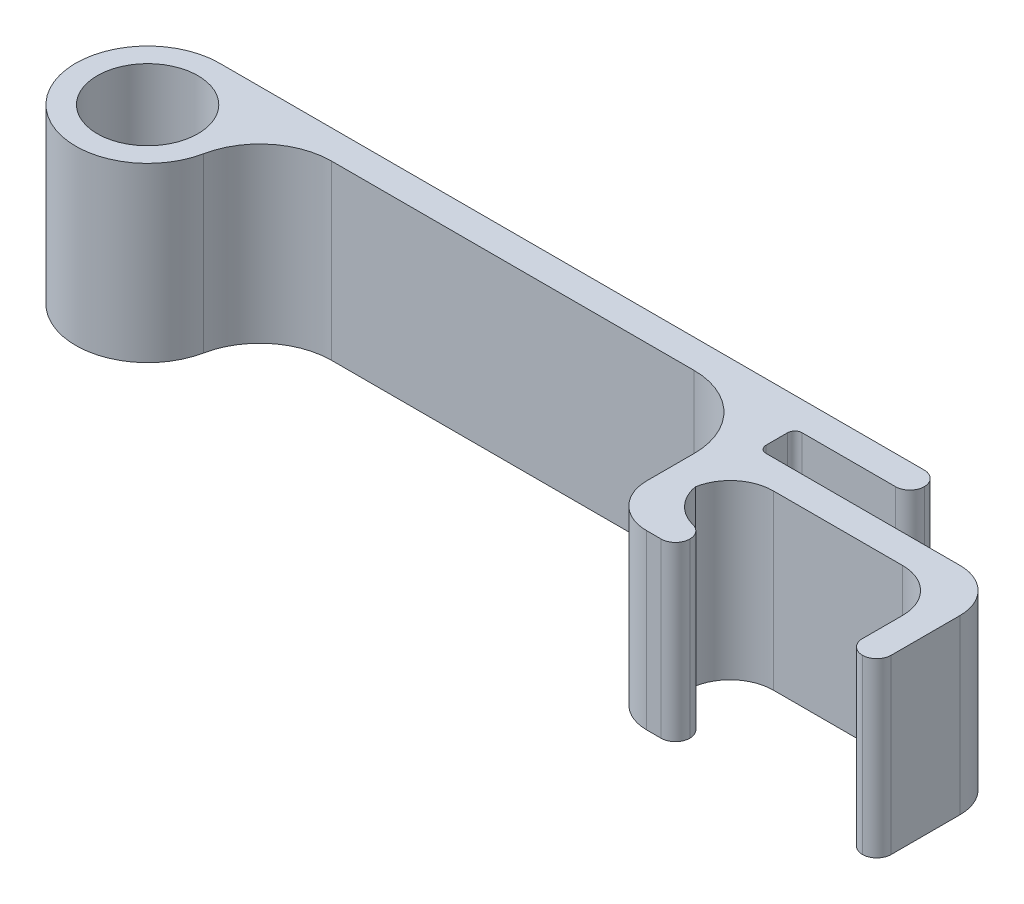
from build123d import *

# Parameters (mm, degrees)
SKETCH1_R           = 5
BOSS_EXTRUDE1_DEPTH = 12
SKETCH2_R           = 3.5
CUT_EXTRUDE1_DEPTH  = 14.928388277
BOSS_EXTRUDE2_START = -12
BOSS_EXTRUDE2_DEPTH = 12
BOSS_EXTRUDE3_DEPTH = 12
BOSS_EXTRUDE4_DEPTH = 12
FILLET1_R           = 1
FILLET2_R           = 3
FILLET3_R           = 5
FILLET4_R           = 5
FILLET5_R           = 0.5
SKETCH7_W           = 0.628205129
SKETCH7_H           = 3.58974359
CUT_EXTRUDE2_DEPTH  = 0.5


# Some blends are built 0.0001 mm under size
with BuildPart() as part:
    # Sketch1 → Boss-Extrude1 (new body)
    with BuildSketch(Plane(origin=(0, 0, 0), x_dir=(1, 0, 0), z_dir=(0, 1, 0))):
        with Locations(Location((0, 0, 0), (0, 0, 270))):
            Circle(SKETCH1_R)
    extrude(amount=BOSS_EXTRUDE1_DEPTH)

    # Sketch2 → Cut-Extrude1 (cut, through all)
    with BuildSketch(Plane(origin=(0, 12, 0), x_dir=(1, 0, 0), z_dir=(0, 1, 0))):
        with Locations(Location((0, 0, 0), (0, 0, 270))):
            Circle(SKETCH2_R)
    extrude(amount=-CUT_EXTRUDE1_DEPTH, mode=Mode.SUBTRACT)

    # Sketch3 → Boss-Extrude2 (add)
    with BuildSketch(Plane(origin=(0, 12, 0), x_dir=(1, 0, 0), z_dir=(0, 1, 0)).offset(BOSS_EXTRUDE2_START)):
        with BuildLine():
            Line((0, 5), (50, 5))
            Line((50, 5), (50, 3))
            Line((50, 3), (4, 3))
            ThreePointArc((4, 3), (2.236067977, 4.472135955), (0, 5))
        make_face()
    extrude(amount=BOSS_EXTRUDE2_DEPTH)

    # Sketch4 → Boss-Extrude3 (add)
    with BuildSketch(Plane(origin=(0, 12, 0), x_dir=(1, 0, 0), z_dir=(0, 1, 0))):
        Polygon((40, 3), (40, -8.3), (45, -8.3), (45, -6.3), (42, -6.3), (42, 3), align=None)
    extrude(amount=-BOSS_EXTRUDE3_DEPTH)

    # Sketch6 → Boss-Extrude4 (add)
    with BuildSketch(Plane(origin=(0, 12, 0), x_dir=(1, 0, 0), z_dir=(0, 1, 0))):
        Polygon((42, 0.5), (59, 0.5), (59, -1.5), (59, -8.3), (57, -8.3), (57, -1.5), (42, -1.5), align=None)
    extrude(amount=-BOSS_EXTRUDE4_DEPTH)

    # Fillet1
    fillet1_edges = [part.edges().sort_by_distance(p)[0] for p in [
        (59, 6, 8.3),
        (57, 6, 8.3),
        (45, 6, 8.3),
        (45, 6, 6.3),
        (50, 6, -5),
        (50, 6, -3),
    ]]
    fillet(fillet1_edges, radius=FILLET1_R - 0.0001)  # a hair under: the kernel refuses the full size

    # Fillet2
    # the kernel refuses this fillet: 3 mm, written as the material it adds along each edge
    with BuildSketch(Plane(origin=(57, 12, 1.5), x_dir=(0, 0, 1), z_dir=(0, -1, 0)), Plane(origin=(42, 12, 1.5), x_dir=(1, 0, 0), z_dir=(0, -1, 0))) as fillet2_piece_1:
        with BuildLine():
            CenterArc((FILLET2_R, FILLET2_R), FILLET2_R, 180, 90)
            Line((0, FILLET2_R), (0, 0))
            Line((0, 0), (FILLET2_R, 0))
        make_face()
    extrude(amount=12)
    with BuildSketch(Plane(origin=(42, 12, 6.3), x_dir=(0, 0, -1), z_dir=(0, -1, 0))) as fillet2_piece_2:
        with BuildLine():
            CenterArc((2.873005886, 3), FILLET2_R, 194.476402633, 75.523597367)
            Line((-0.031746147, 2.250056251), (-0.322221351, 2.175061877))
            ThreePointArc((-0.322221351, 2.175061877), (-0.3, 2.0001), (-0.3, 0))
            Line((-0.3, 0), (0, -0.3))
            Line((0, -0.3), (2.873005886, -0.3))
            Line((2.873005886, -0.3), (2.873005886, 0))
        make_face()
    extrude(amount=12)
    # the kernel refuses this fillet: 3 mm, written as the material it takes off along each edge
    with BuildSketch(Plane(origin=(59, 19.5, -0.5), x_dir=(-1, 0, 0), z_dir=(0, -1, 0)), Plane(origin=(40, 19.5, 8.3), x_dir=(1, 0, 0), z_dir=(0, -1, 0))) as fillet2_2_piece_1:
        with BuildLine():
            CenterArc((FILLET2_R, -FILLET2_R), FILLET2_R, 90, 90)
            Line((0, -FILLET2_R), (0, 0))
            Line((0, 0), (FILLET2_R, 0))
        make_face()
    extrude(amount=27, mode=Mode.SUBTRACT)

    # Fillet3
    fillet3_edges = [part.edges().sort_by_distance(p)[0] for p in [
        (40, 6, -3),
    ]]
    fillet(fillet3_edges, radius=FILLET3_R)

    # Fillet4
    fillet4_edges = [part.edges().sort_by_distance(p)[0] for p in [
        (4, 6, -3),
    ]]
    fillet(fillet4_edges, radius=FILLET4_R)

    # Fillet5
    fillet5_edges = [part.edges().sort_by_distance(p)[0] for p in [
        (42, 6, -3),
        (42, 6, -0.5),
    ]]
    fillet(fillet5_edges, radius=FILLET5_R)

    # Sketch7 → Cut-Extrude2 (cut)
    # profile 1 of 8: a face of its own
    with BuildSketch(Plane(origin=(0, 0, -5), x_dir=(-1, 0, 0), z_dir=(0, 0, -1))):
        Polygon((-34.160296283, 7.658316714), (-33.577664072, 7.658316714), (-32.164202533, 4.158316714), (-32.835176091, 4.158316714), (-33.107211347, 4.876265432), (-34.632151251, 4.876265432), (-34.904186507, 4.158316714), (-35.574458943, 4.158316714), align=None)
        Polygon((-33.869330738, 6.719514631), (-34.393769841, 5.50447056), (-33.344891636, 5.50447056), align=None, mode=Mode.SUBTRACT)
    # profile 2 of 8: a face of its own
    with BuildSketch(Plane(origin=(0, 0, -5), x_dir=(-1, 0, 0), z_dir=(0, 0, -1))):
        with Locations((-31.468689713, 5.953188509)):
            Rectangle(SKETCH7_W, SKETCH7_H)
    # profile 3 of 8: a face of its own
    with BuildSketch(Plane(origin=(0, 0, -5), x_dir=(-1, 0, 0), z_dir=(0, 0, -1))):
        with BuildLine():
            Line((-28.015664873, 5.280111586), (-30.032792277, 5.280111586))
            add(Edge.make_bspline(
                [(-30.032792277, 5.280111586), (-30.028679517, 5.25667371), (-30.020597619, 5.210616434), (-30.003047491, 5.143714245), (-29.980650895, 5.080666751), (-29.953809986, 5.021389673), (-29.9229773, 4.965569637), (-29.887013527, 4.91346846), (-29.846374833, 4.865132162), (-29.801296182, 4.820770818), (-29.752528952, 4.781022091), (-29.700309646, 4.746199694), (-29.644584378, 4.717647459), (-29.585992016, 4.693580887), (-29.524094741, 4.674517725), (-29.458801455, 4.661370224), (-29.390285242, 4.653603947), (-29.343609904, 4.652480644), (-29.319751411, 4.651906458)],
                knots=[0, 0, 0, 0, 1.091296461, 2.144483647, 3.168565212, 4.157007626, 5.126487748, 6.090021542, 7.05641414, 8.019231907, 8.98705074, 9.938580405, 10.892824166, 11.854447369, 12.841318655, 13.858982407, 14.905600794, 16, 16, 16, 16], degree=3))
            add(Edge.make_bspline(
                [(-29.319751411, 4.651906458), (-29.290952591, 4.652666775), (-29.234239233, 4.654164062), (-29.151153741, 4.667442778), (-29.070797967, 4.687499694), (-28.993932361, 4.717326013), (-28.919666554, 4.754454536), (-28.84922319, 4.800712108), (-28.78138295, 4.85474693), (-28.739992409, 4.89639695), (-28.718890033, 4.917631618)],
                knots=[0, 0, 0, 0, 1.021034703, 2.010718019, 2.977989445, 3.954245119, 4.929443971, 5.918328161, 6.938689359, 8, 8, 8, 8], degree=3))
            Line((-28.718890033, 4.917631618), (-28.193048687, 4.667331137))
            add(Edge.make_bspline(
                [(-28.193048687, 4.667331137), (-28.209604495, 4.644453552), (-28.242409219, 4.599122457), (-28.295961831, 4.5353299), (-28.351847392, 4.475808856), (-28.41010758, 4.420950804), (-28.470816285, 4.370912068), (-28.533804629, 4.325083087), (-28.599993162, 4.284694349), (-28.668058456, 4.247791872), (-28.739407546, 4.216155549), (-28.813842978, 4.18917721), (-28.891049475, 4.164789021), (-28.97200199, 4.146206557), (-29.056026432, 4.131496831), (-29.143323802, 4.121050976), (-29.233882597, 4.114599072), (-29.295434882, 4.113834206), (-29.326762629, 4.113444919)],
                knots=[0, 0, 0, 0, 1.028154879, 2.037251081, 3.030720504, 4.000128189, 4.949298328, 5.894184978, 6.834267904, 7.770992897, 8.712077017, 9.673380525, 10.653304757, 11.658697181, 12.695551717, 13.758623199, 14.859225354, 16, 16, 16, 16], degree=3))
            add(Edge.make_bspline(
                [(-29.326762629, 4.113444919), (-29.374959854, 4.114427516), (-29.469351341, 4.116351874), (-29.607415955, 4.134212675), (-29.738539044, 4.163827807), (-29.863090854, 4.204085031), (-29.98053299, 4.257237178), (-30.090923575, 4.322246663), (-30.195365567, 4.397867125), (-30.290667681, 4.485685634), (-30.377490719, 4.581270861), (-30.453750677, 4.683922867), (-30.517563924, 4.792924462), (-30.569968645, 4.907554251), (-30.610699416, 5.02810564), (-30.640063938, 5.154631237), (-30.658064743, 5.287070609), (-30.660008919, 5.377276605), (-30.660997405, 5.423140432)],
                knots=[0, 0, 0, 0, 1.103565453, 2.161269334, 3.182010356, 4.179077853, 5.15417608, 6.128274628, 7.109042802, 8.101804412, 9.090965879, 10.063106201, 11.02526161, 11.978650795, 12.945248442, 13.93468508, 14.949922959, 16, 16, 16, 16], degree=3))
            add(Edge.make_bspline(
                [(-30.660997405, 5.423140432), (-30.65999919, 5.470169718), (-30.658035247, 5.562697725), (-30.640218925, 5.698195183), (-30.610618233, 5.827478085), (-30.569768316, 5.950724467), (-30.51815858, 6.06831979), (-30.453533419, 6.179235237), (-30.377528562, 6.283856955), (-30.291018303, 6.381695513), (-30.19531246, 6.470005501), (-30.093615959, 6.548707348), (-29.984786137, 6.61428695), (-29.870053952, 6.667275229), (-29.750153273, 6.710326868), (-29.623698215, 6.738974138), (-29.491650909, 6.758209065), (-29.401386279, 6.759980481), (-29.355508623, 6.760880817)],
                knots=[0, 0, 0, 0, 1.079208495, 2.12329425, 3.130605359, 4.119693003, 5.099659317, 6.073216462, 7.060498243, 8.06384408, 9.066070512, 10.045757761, 11.010926815, 11.975797609, 12.942977511, 13.929384301, 14.947594487, 16, 16, 16, 16], degree=3))
            add(Edge.make_bspline(
                [(-29.355508623, 6.760880817), (-29.3070805, 6.759882976), (-29.211996873, 6.757923819), (-29.072970682, 6.740208044), (-28.940976952, 6.710412322), (-28.815453314, 6.670503195), (-28.698002758, 6.616008369), (-28.586044539, 6.552598664), (-28.482264049, 6.475343609), (-28.385555099, 6.387954855), (-28.298255507, 6.291000061), (-28.221945991, 6.18567746), (-28.157015985, 6.073014937), (-28.10438957, 5.952555624), (-28.063700623, 5.82466115), (-28.034308918, 5.689497612), (-28.016445417, 5.546550912), (-28.014537418, 5.448667114), (-28.013561507, 5.398601169)],
                knots=[0, 0, 0, 0, 1.080001299, 2.120471247, 3.119684163, 4.095710327, 5.052285597, 6.002875087, 6.961153713, 7.931888285, 8.906493152, 9.865905668, 10.82813294, 11.801621613, 12.7925306, 13.817193356, 14.883530496, 16, 16, 16, 16], degree=3))
            Line((-28.013561507, 5.398601169), (-28.015664873, 5.280111586))
        make_face()
        with BuildLine():
            add(Edge.make_bspline(
                [(-28.641766636, 5.77370133), (-28.653621251, 5.805692133), (-28.677191313, 5.869298185), (-28.730435104, 5.957059016), (-28.801087911, 6.03306346), (-28.883262194, 6.100350797), (-28.977151457, 6.154965403), (-29.079797087, 6.194508151), (-29.189901661, 6.218218479), (-29.265647674, 6.220999284), (-29.304326732, 6.222419278)],
                knots=[0, 0, 0, 0, 0.954238005, 1.897273737, 2.851915805, 3.847685534, 4.862635127, 5.880135777, 6.917509367, 8, 8, 8, 8], degree=3))
            add(Edge.make_bspline(
                [(-29.304326732, 6.222419278), (-29.34657056, 6.221055201), (-29.429148448, 6.218388713), (-29.54826143, 6.19002964), (-29.660617725, 6.147704571), (-29.726856629, 6.104066526), (-29.760055898, 6.082194919)],
                knots=[0, 0, 0, 0, 1.044195649, 2.041185066, 3.018232172, 4, 4, 4, 4], degree=3))
            add(Edge.make_bspline(
                [(-29.760055898, 6.082194919), (-29.780769763, 6.065537025), (-29.824930663, 6.030023246), (-29.882282552, 5.959176628), (-29.938774639, 5.873397277), (-29.970893505, 5.808241801), (-29.987920482, 5.77370133)],
                knots=[0, 0, 0, 0, 0.82159062, 1.751589201, 2.808063854, 4, 4, 4, 4], degree=3))
            Line((-29.987920482, 5.77370133), (-28.641766636, 5.77370133))
        make_face(mode=Mode.SUBTRACT)
    # profile 4 of 8: a face of its own
    with BuildSketch(Plane(origin=(0, 0, -5), x_dir=(-1, 0, 0), z_dir=(0, 0, -1))):
        Polygon((-27.660897245, 6.716009022), (-26.95206311, 6.716009022), (-26.446554296, 6.019093958), (-25.943148847, 6.716009022), (-25.234314713, 6.716009022), (-26.091085546, 5.529009823), (-25.096894841, 4.158316714), (-25.805728975, 4.158316714), (-26.44445093, 5.038925689), (-27.080368398, 4.158316714), (-27.789202533, 4.158316714), (-26.79991968, 5.529009823), align=None)
    # profile 5 of 8: a face of its own
    with BuildSketch(Plane(origin=(0, 0, -5), x_dir=(-1, 0, 0), z_dir=(0, 0, -1))):
        Polygon((-23.346894841, 7.658316714), (-21.641766636, 7.658316714), (-21.641766636, 7.030111586), (-22.718689713, 7.030111586), (-22.718689713, 6.357034663), (-21.641766636, 6.357034663), (-21.641766636, 5.728829535), (-22.718689713, 5.728829535), (-22.718689713, 4.158316714), (-23.346894841, 4.158316714), align=None)
    # profile 6 of 8: a face of its own
    with BuildSketch(Plane(origin=(0, 0, -5), x_dir=(-1, 0, 0), z_dir=(0, 0, -1))):
        with BuildLine():
            Line((-19.173817918, 6.716009022), (-18.545612789, 6.716009022))
            Line((-18.545612789, 6.716009022), (-18.545612789, 4.158316714))
            Line((-18.545612789, 4.158316714), (-19.173817918, 4.158316714))
            Line((-19.173817918, 4.158316714), (-19.173817918, 4.437363189))
            add(Edge.make_bspline(
                [(-19.173817918, 4.437363189), (-19.20494525, 4.410201103), (-19.265357256, 4.357484858), (-19.360547029, 4.28908419), (-19.456014957, 4.232662479), (-19.552219767, 4.187725664), (-19.650640085, 4.154544451), (-19.7519845, 4.130520477), (-19.857712478, 4.116352952), (-19.929584901, 4.114424361), (-19.966085546, 4.113444919)],
                knots=[0, 0, 0, 0, 1.129196829, 2.191548051, 3.199897424, 4.157751732, 5.089409408, 6.034969131, 7.002052659, 8, 8, 8, 8], degree=3))
            add(Edge.make_bspline(
                [(-19.966085546, 4.113444919), (-20.007059142, 4.114366697), (-20.08802529, 4.116188182), (-20.206834124, 4.135362252), (-20.321555864, 4.164712439), (-20.43209739, 4.206246622), (-20.538257579, 4.260066781), (-20.640848881, 4.324768672), (-20.738112566, 4.402623719), (-20.830858323, 4.490263333), (-20.915775782, 4.586667531), (-20.990011426, 4.690498238), (-21.052586557, 4.800282843), (-21.103851013, 4.91565736), (-21.144177128, 5.03653711), (-21.172923878, 5.163305488), (-21.189884493, 5.296007769), (-21.191983739, 5.386399366), (-21.193048687, 5.432255016)],
                knots=[0, 0, 0, 0, 0.980476535, 1.937477201, 2.874147792, 3.812856188, 4.758993464, 5.720109578, 6.712210464, 7.737600662, 8.772720504, 9.783789959, 10.789002326, 11.793715968, 12.802552247, 13.835794126, 14.902098527, 16, 16, 16, 16], degree=3))
            add(Edge.make_bspline(
                [(-21.193048687, 5.432255016), (-21.191931021, 5.479738601), (-21.189738593, 5.572882946), (-21.17370112, 5.709567843), (-21.145484856, 5.839479432), (-21.107009952, 5.962797661), (-21.057518669, 6.079543833), (-20.997241593, 6.189909217), (-20.925358711, 6.293605334), (-20.842526432, 6.388867204), (-20.753087916, 6.47617931), (-20.657404514, 6.552191422), (-20.556972507, 6.616767248), (-20.451685168, 6.669486181), (-20.341557532, 6.710224705), (-20.227024382, 6.740007893), (-20.10757727, 6.757878852), (-20.02620893, 6.759871852), (-19.985015834, 6.760880817)],
                knots=[0, 0, 0, 0, 1.136281865, 2.228943489, 3.287578264, 4.313574083, 5.316051562, 6.317280042, 7.318008486, 8.329309503, 9.333984563, 10.305318864, 11.248632312, 12.186624717, 13.117503092, 14.05354244, 15.014596925, 16, 16, 16, 16], degree=3))
            add(Edge.make_bspline(
                [(-19.985015834, 6.760880817), (-19.94685768, 6.760088073), (-19.871356447, 6.758519519), (-19.760380513, 6.741488026), (-19.652749864, 6.715729101), (-19.549051628, 6.67902727), (-19.44843524, 6.632683741), (-19.352631365, 6.574611846), (-19.259544206, 6.507252319), (-19.202746402, 6.454643102), (-19.173817918, 6.427847964)],
                knots=[0, 0, 0, 0, 1.017011718, 2.012299608, 2.98747302, 3.965332399, 4.941441765, 5.936729654, 6.94912688, 8, 8, 8, 8], degree=3))
            Line((-19.173817918, 6.427847964), (-19.173817918, 6.716009022))
        make_face()
        with BuildLine():
            add(Edge.make_bspline(
                [(-19.853204937, 6.177547484), (-19.878237059, 6.176779412), (-19.927298385, 6.175274041), (-19.999449779, 6.16621913), (-20.068404866, 6.150263974), (-20.133671866, 6.126693658), (-20.196223495, 6.097981578), (-20.255109899, 6.062020171), (-20.310817083, 6.019514552), (-20.363017429, 5.971493781), (-20.410605735, 5.918710174), (-20.451629632, 5.861111823), (-20.486493317, 5.800250675), (-20.515978934, 5.735943743), (-20.537083946, 5.667430076), (-20.553799106, 5.595601601), (-20.562473192, 5.519871515), (-20.564045531, 5.468263805), (-20.564843559, 5.442070721)],
                knots=[0, 0, 0, 0, 1.04836806, 2.054732945, 3.03993516, 4.00574415, 4.955904794, 5.917688631, 6.888591924, 7.88601754, 8.884115178, 9.859153345, 10.841239365, 11.818093293, 12.814750328, 13.83810466, 14.90274714, 16, 16, 16, 16], degree=3))
            add(Edge.make_bspline(
                [(-20.564843559, 5.442070721), (-20.564057721, 5.41564005), (-20.562509237, 5.36355872), (-20.553658855, 5.287189823), (-20.537545175, 5.214312103), (-20.514035923, 5.145514724), (-20.485325673, 5.079869384), (-20.450378843, 5.017679041), (-20.407452783, 4.960043299), (-20.359822761, 4.905598302), (-20.306551533, 4.856981032), (-20.250529135, 4.813813361), (-20.190990345, 4.777694998), (-20.128581116, 4.748503908), (-20.063511521, 4.724715624), (-19.994965784, 4.708960992), (-19.923615397, 4.698889353), (-19.874973954, 4.697486812), (-19.85040045, 4.696778253)],
                knots=[0, 0, 0, 0, 1.099136573, 2.165835871, 3.191374663, 4.196217796, 5.183857741, 6.167377911, 7.154730987, 8.166690795, 9.170734848, 10.148332609, 11.103258353, 12.059567475, 13.009337315, 13.978056681, 14.978520572, 16, 16, 16, 16], degree=3))
            add(Edge.make_bspline(
                [(-19.85040045, 4.696778253), (-19.824902075, 4.697550631), (-19.774911398, 4.699064911), (-19.701582891, 4.708037186), (-19.631701489, 4.724050843), (-19.565557937, 4.747756105), (-19.502141954, 4.776262089), (-19.442025812, 4.811520782), (-19.385861863, 4.853928863), (-19.333365663, 4.902383743), (-19.285263014, 4.955598359), (-19.243671789, 5.013952022), (-19.20744431, 5.075578419), (-19.178953064, 5.141934625), (-19.15632702, 5.211859714), (-19.140093355, 5.285787658), (-19.131263183, 5.363798159), (-19.129728241, 5.417043366), (-19.128946123, 5.444174086)],
                knots=[0, 0, 0, 0, 1.050008698, 2.058587853, 3.036635738, 3.995319155, 4.947022481, 5.895997462, 6.858296291, 7.838991643, 8.833936038, 9.806048392, 10.784806122, 11.771666913, 12.772873988, 13.80724452, 14.882696879, 16, 16, 16, 16], degree=3))
            add(Edge.make_bspline(
                [(-19.128946123, 5.444174086), (-19.129718523, 5.470838171), (-19.131227244, 5.522920874), (-19.140131437, 5.599302553), (-19.156480352, 5.671778889), (-19.178640715, 5.740483105), (-19.207638828, 5.805258107), (-19.243893718, 5.865385697), (-19.285028712, 5.922949069), (-19.333663926, 5.974726065), (-19.385875743, 6.022830094), (-19.442865674, 6.063955723), (-19.502838226, 6.099398932), (-19.566161872, 6.128499173), (-19.63342296, 6.149830752), (-19.703423785, 6.166347014), (-19.777256503, 6.175268606), (-19.827475662, 6.176775462), (-19.853204937, 6.177547484)],
                knots=[0, 0, 0, 0, 1.106611376, 2.161533483, 3.185006901, 4.184773755, 5.152708835, 6.122342771, 7.094156588, 8.082475533, 9.064254463, 10.03606828, 10.992420271, 11.951521816, 12.920622147, 13.915721683, 14.932141191, 16, 16, 16, 16], degree=3))
        make_face(mode=Mode.SUBTRACT)
    # profile 7 of 8: a face of its own
    with BuildSketch(Plane(origin=(0, 0, -5), x_dir=(-1, 0, 0), z_dir=(0, 0, -1))):
        with BuildLine():
            Line((-18.007151251, 6.716009022), (-17.468689713, 6.716009022))
            Line((-17.468689713, 6.716009022), (-17.468689713, 6.401205336))
            add(Edge.make_bspline(
                [(-17.468689713, 6.401205336), (-17.453457669, 6.429182026), (-17.423686009, 6.483863628), (-17.368992972, 6.557262849), (-17.306159396, 6.619077626), (-17.237443085, 6.670600869), (-17.162635774, 6.710758179), (-17.08374067, 6.739375324), (-17.001432719, 6.757972503), (-16.945285024, 6.759904399), (-16.91690686, 6.760880817)],
                knots=[0, 0, 0, 0, 1.09866127, 2.147379032, 3.14564304, 4.131443017, 5.102343063, 6.064490016, 7.021754664, 8, 8, 8, 8], degree=3))
            add(Edge.make_bspline(
                [(-16.91690686, 6.760880817), (-16.896300772, 6.759915912), (-16.854339418, 6.75795102), (-16.79038441, 6.746529074), (-16.725506644, 6.725876023), (-16.682811484, 6.707280696), (-16.660997405, 6.697779855)],
                knots=[0, 0, 0, 0, 0.931404136, 1.896671404, 2.925354185, 4, 4, 4, 4], degree=3))
            Line((-16.660997405, 6.697779855), (-16.855909264, 6.165628413))
            add(Edge.make_bspline(
                [(-16.855909264, 6.165628413), (-16.873331601, 6.174046044), (-16.906078887, 6.189867949), (-16.953622261, 6.208539428), (-16.996769844, 6.219931851), (-17.02412462, 6.221631701), (-17.036798687, 6.222419278)],
                knots=[0, 0, 0, 0, 1.214386998, 2.282580073, 3.20428172, 4, 4, 4, 4], degree=3))
            add(Edge.make_bspline(
                [(-17.036798687, 6.222419278), (-17.048765471, 6.221897388), (-17.072306197, 6.22087074), (-17.107051649, 6.212072711), (-17.13977463, 6.196900784), (-17.172052058, 6.177464039), (-17.201337602, 6.15044551), (-17.230605057, 6.119166765), (-17.256397105, 6.080548995), (-17.283615196, 6.037565455), (-17.306790427, 5.984953641), (-17.326662475, 5.922145977), (-17.344368628, 5.848415736), (-17.356552879, 5.763371445), (-17.368329447, 5.667836055), (-17.37533915, 5.561108348), (-17.38056357, 5.443525808), (-17.380883008, 5.361448951), (-17.381049488, 5.318673285)],
                knots=[0, 0, 0, 0, 0.544232178, 1.070598461, 1.618251235, 2.182094276, 2.777567932, 3.425210017, 4.127676488, 4.886675562, 5.738955394, 6.734782583, 7.883056018, 9.186093582, 10.642914445, 12.264202625, 14.053029461, 16, 16, 16, 16], degree=3))
            Line((-17.381049488, 5.318673285), (-17.378946123, 5.193873605))
            Line((-17.378946123, 5.193873605), (-17.378946123, 4.158316714))
            Line((-17.378946123, 4.158316714), (-18.007151251, 4.158316714))
            Line((-18.007151251, 4.158316714), (-18.007151251, 6.716009022))
        make_face()
    # profile 8 of 8: a face of its own
    with BuildSketch(Plane(origin=(0, 0, -5), x_dir=(-1, 0, 0), z_dir=(0, 0, -1))):
        with BuildLine():
            Line((-13.791305898, 5.280111586), (-15.808433302, 5.280111586))
            add(Edge.make_bspline(
                [(-15.808433302, 5.280111586), (-15.804320542, 5.25667371), (-15.796238645, 5.210616434), (-15.778688517, 5.143714245), (-15.756291921, 5.080666751), (-15.729451012, 5.021389673), (-15.698618326, 4.965569637), (-15.662654552, 4.91346846), (-15.622015859, 4.865132162), (-15.576937208, 4.820770818), (-15.528169978, 4.781022091), (-15.475950672, 4.746199694), (-15.420225403, 4.717647459), (-15.361633041, 4.693580887), (-15.299735766, 4.674517725), (-15.234442481, 4.661370224), (-15.165926267, 4.653603947), (-15.11925093, 4.652480644), (-15.095392437, 4.651906458)],
                knots=[0, 0, 0, 0, 1.091296461, 2.144483647, 3.168565212, 4.157007626, 5.126487748, 6.090021542, 7.05641414, 8.019231907, 8.98705074, 9.938580405, 10.892824166, 11.854447369, 12.841318655, 13.858982407, 14.905600794, 16, 16, 16, 16], degree=3))
            add(Edge.make_bspline(
                [(-15.095392437, 4.651906458), (-15.066593617, 4.652666775), (-15.009880258, 4.654164062), (-14.926794766, 4.667442778), (-14.846438993, 4.687499694), (-14.769573386, 4.717326013), (-14.69530758, 4.754454536), (-14.624864216, 4.800712108), (-14.557023976, 4.85474693), (-14.515633435, 4.89639695), (-14.494531059, 4.917631618)],
                knots=[0, 0, 0, 0, 1.021034703, 2.010718019, 2.977989445, 3.954245119, 4.929443971, 5.918328161, 6.938689359, 8, 8, 8, 8], degree=3))
            Line((-14.494531059, 4.917631618), (-13.968689713, 4.667331137))
            add(Edge.make_bspline(
                [(-13.968689713, 4.667331137), (-13.98524552, 4.644453552), (-14.018050245, 4.599122457), (-14.071602857, 4.5353299), (-14.127488417, 4.475808856), (-14.185748606, 4.420950804), (-14.246457311, 4.370912068), (-14.309445655, 4.325083087), (-14.375634188, 4.284694349), (-14.443699482, 4.247791872), (-14.515048572, 4.216155549), (-14.589484003, 4.18917721), (-14.666690501, 4.164789021), (-14.747643016, 4.146206557), (-14.831667457, 4.131496831), (-14.918964828, 4.121050976), (-15.009523622, 4.114599072), (-15.071075907, 4.113834206), (-15.102403655, 4.113444919)],
                knots=[0, 0, 0, 0, 1.028154879, 2.037251081, 3.030720504, 4.000128189, 4.949298328, 5.894184978, 6.834267904, 7.770992897, 8.712077017, 9.673380525, 10.653304757, 11.658697181, 12.695551717, 13.758623199, 14.859225354, 16, 16, 16, 16], degree=3))
            add(Edge.make_bspline(
                [(-15.102403655, 4.113444919), (-15.15060088, 4.114427516), (-15.244992367, 4.116351874), (-15.38305698, 4.134212675), (-15.514180069, 4.163827807), (-15.63873188, 4.204085031), (-15.756174016, 4.257237178), (-15.8665646, 4.322246663), (-15.971006592, 4.397867125), (-16.066308707, 4.485685634), (-16.153131744, 4.581270861), (-16.229391702, 4.683922867), (-16.293204949, 4.792924462), (-16.345609671, 4.907554251), (-16.386340441, 5.02810564), (-16.415704964, 5.154631237), (-16.433705768, 5.287070609), (-16.435649944, 5.377276605), (-16.43663843, 5.423140432)],
                knots=[0, 0, 0, 0, 1.103565453, 2.161269334, 3.182010356, 4.179077853, 5.15417608, 6.128274628, 7.109042802, 8.101804412, 9.090965879, 10.063106201, 11.02526161, 11.978650795, 12.945248442, 13.93468508, 14.949922959, 16, 16, 16, 16], degree=3))
            add(Edge.make_bspline(
                [(-16.43663843, 5.423140432), (-16.435640216, 5.470169718), (-16.433676273, 5.562697725), (-16.415859951, 5.698195183), (-16.386259258, 5.827478085), (-16.345409342, 5.950724467), (-16.293799606, 6.06831979), (-16.229174445, 6.179235237), (-16.153169588, 6.283856955), (-16.066659329, 6.381695513), (-15.970953485, 6.470005501), (-15.869256985, 6.548707348), (-15.760427162, 6.61428695), (-15.645694978, 6.667275229), (-15.525794298, 6.710326868), (-15.399339241, 6.738974138), (-15.267291935, 6.758209065), (-15.177027304, 6.759980481), (-15.131149648, 6.760880817)],
                knots=[0, 0, 0, 0, 1.079208495, 2.12329425, 3.130605359, 4.119693003, 5.099659317, 6.073216462, 7.060498243, 8.06384408, 9.066070512, 10.045757761, 11.010926815, 11.975797609, 12.942977511, 13.929384301, 14.947594487, 16, 16, 16, 16], degree=3))
            add(Edge.make_bspline(
                [(-15.131149648, 6.760880817), (-15.082721526, 6.759882976), (-14.987637899, 6.757923819), (-14.848611708, 6.740208044), (-14.716617978, 6.710412322), (-14.59109434, 6.670503195), (-14.473643784, 6.616008369), (-14.361685565, 6.552598664), (-14.257905075, 6.475343609), (-14.161196125, 6.387954855), (-14.073896533, 6.291000061), (-13.997587017, 6.18567746), (-13.932657011, 6.073014937), (-13.880030596, 5.952555624), (-13.839341649, 5.82466115), (-13.809949944, 5.689497612), (-13.792086443, 5.546550912), (-13.790178443, 5.448667114), (-13.789202533, 5.398601169)],
                knots=[0, 0, 0, 0, 1.080001299, 2.120471247, 3.119684163, 4.095710327, 5.052285597, 6.002875087, 6.961153713, 7.931888285, 8.906493152, 9.865905668, 10.82813294, 11.801621613, 12.7925306, 13.817193356, 14.883530496, 16, 16, 16, 16], degree=3))
            Line((-13.789202533, 5.398601169), (-13.791305898, 5.280111586))
        make_face()
        with BuildLine():
            add(Edge.make_bspline(
                [(-14.417407661, 5.77370133), (-14.429262276, 5.805692133), (-14.452832339, 5.869298185), (-14.50607613, 5.957059016), (-14.576728936, 6.03306346), (-14.658903219, 6.100350797), (-14.752792483, 6.154965403), (-14.855438112, 6.194508151), (-14.965542686, 6.218218479), (-15.0412887, 6.220999284), (-15.079967757, 6.222419278)],
                knots=[0, 0, 0, 0, 0.954238005, 1.897273737, 2.851915805, 3.847685534, 4.862635127, 5.880135777, 6.917509367, 8, 8, 8, 8], degree=3))
            add(Edge.make_bspline(
                [(-15.079967757, 6.222419278), (-15.122211586, 6.221055201), (-15.204789474, 6.218388713), (-15.323902456, 6.19002964), (-15.436258751, 6.147704571), (-15.502497655, 6.104066526), (-15.535696924, 6.082194919)],
                knots=[0, 0, 0, 0, 1.044195649, 2.041185066, 3.018232172, 4, 4, 4, 4], degree=3))
            add(Edge.make_bspline(
                [(-15.535696924, 6.082194919), (-15.556410789, 6.065537025), (-15.600571689, 6.030023246), (-15.657923577, 5.959176628), (-15.714415665, 5.873397277), (-15.746534531, 5.808241801), (-15.763561507, 5.77370133)],
                knots=[0, 0, 0, 0, 0.82159062, 1.751589201, 2.808063854, 4, 4, 4, 4], degree=3))
            Line((-15.763561507, 5.77370133), (-14.417407661, 5.77370133))
        make_face(mode=Mode.SUBTRACT)
    extrude(amount=-CUT_EXTRUDE2_DEPTH, mode=Mode.SUBTRACT)


solid = part.part
